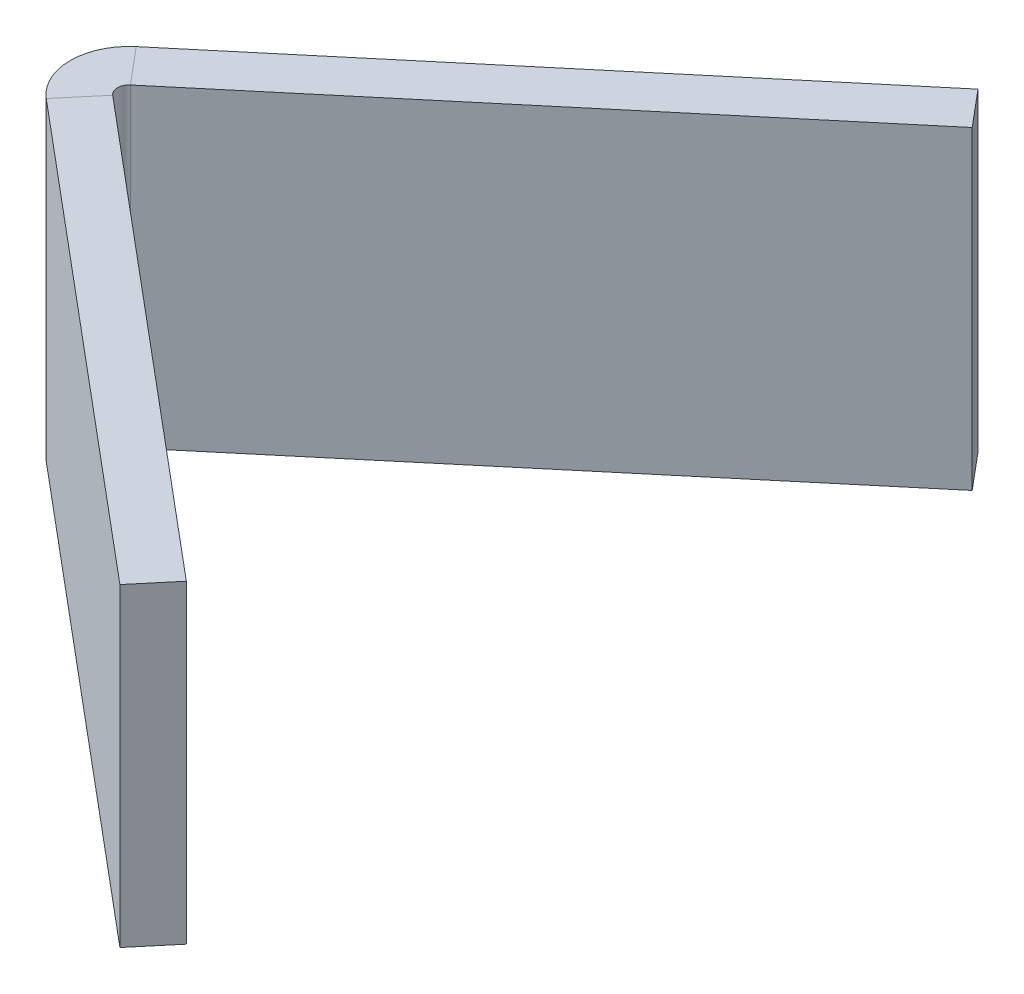
from build123d import *

# Parameters (mm, degrees)
SM_BASE_FLANGE_1_DEPTH = 20


# Sheet-metal steps are written as plain solids
with BuildPart() as part:
    # Sketch 1 → 基体-法兰1 (new body)
    with BuildSketch(Plane(origin=(0, 0, 0), x_dir=(1, 0, 0), z_dir=(0, 1, 0))):
        with BuildLine():
            Line((29.793839815, -25), (0.672468818, -0.564268337))
            ThreePointArc((0.672468818, -0.564268337), (0.409346171, 0), (0.672468818, 0.564268337))
            Line((0.672468818, 0.564268337), (29.793839815, 25))
            Line((29.793839815, 25), (27.865476986, 27.298133329))
            Line((27.865476986, 27.298133329), (-1.255894011, 2.862401666))
            ThreePointArc((-1.255894011, 2.862401666), (-2.590653829, 0), (-1.255894011, -2.862401666))
            Line((-1.255894011, -2.862401666), (27.865476986, -27.298133329))
            Line((27.865476986, -27.298133329), (29.793839815, -25))
        make_face()
    extrude(amount=SM_BASE_FLANGE_1_DEPTH)


solid = part.part
